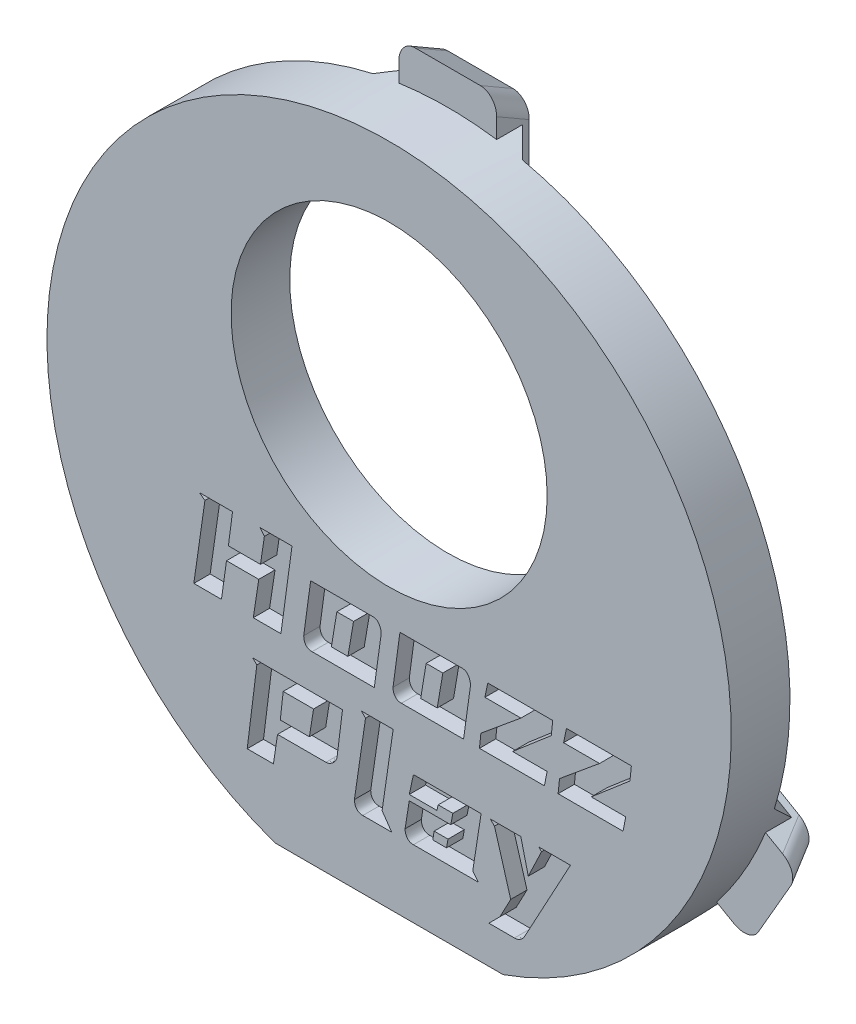
from build123d import *

# Parameters (mm, degrees)
SKETCH_1_R               = 10.5
EXTRUDE_1_DEPTH          = 1.8
CUT_EXTRUDE_4_DEPTH      = 2
CUT_EXTRUDE_4_DEPTH_BACK = 15.957941035
SKETCH_2_R               = 4.85
CUT_EXTRUDE_5_DEPTH      = 15.957941035
CUT_EXTRUDE_5_DEPTH_BACK = 15.957941035
SKETCH_3_W               = 7
SKETCH_3_H               = 1
SKETCH_4_W               = 3
SKETCH_4_H               = 3
EXTRUDE_2_DEPTH          = 1
PATTERN_CIRCULAR_1_COUNT = 3
CHAMFER_1_SIZE           = 1.732050808
CHAMFER_1_SIZE_2         = 1
FILLET_1_R               = 0.5
CHAMFER_2_SIZE           = 0.8
CUT_EXTRUDE_6_DEPTH      = 0.5


with BuildPart() as part:
    # 草图1 → 凸台-拉伸1 (new body)
    with BuildSketch(Plane.XY):
        Circle(SKETCH_1_R)
    extrude(amount=EXTRUDE_1_DEPTH)

    # 草图2 → 切除-拉伸4 (cut, two sides: drawn at the far end of the back side and taken through both)
    with BuildSketch(Plane.XY.offset(-CUT_EXTRUDE_4_DEPTH_BACK)):
        with Locations((0, 3.5)):
            Circle(SKETCH_2_R)
    extrude(amount=CUT_EXTRUDE_4_DEPTH + CUT_EXTRUDE_4_DEPTH_BACK, mode=Mode.SUBTRACT)

    # 草图3 → 切除-拉伸5 (cut, two sides: drawn at the far end of the back side and taken through both)
    with BuildSketch(Plane.XY.offset(-CUT_EXTRUDE_5_DEPTH_BACK)):
        with Locations((0, -10.4)):
            Rectangle(SKETCH_3_W, SKETCH_3_H)
    extrude(amount=CUT_EXTRUDE_5_DEPTH + CUT_EXTRUDE_5_DEPTH_BACK, mode=Mode.SUBTRACT)

    # 草图4 → 凸台-拉伸2 (add)
    with BuildSketch(Plane.XY):
        with Locations((0, 10.5)):
            Rectangle(SKETCH_4_W, SKETCH_4_H)
    extrude_2 = extrude(amount=-EXTRUDE_2_DEPTH)

    # 阵列(圆周)1: 凸台-拉伸2 ×3 about axis
    pattern_circular_1_axis = Axis((0, 0, 0), (0, 0, 1))
    for i in range(1, PATTERN_CIRCULAR_1_COUNT):
        add(extrude_2.rotate(pattern_circular_1_axis, i * 360 / PATTERN_CIRCULAR_1_COUNT))

    # 倒角1
    # the kernel refuses this chamfer: 1.732050808, 1 mm, written as the material it takes off along each edge
    with BuildSketch(Plane(origin=(-5.980963971, 12, -1), x_dir=(0, 0.01932676561270069, 0.9998132206222079), z_dir=(1, 0, 0)), Plane(origin=(-7.40182286, -11.179666738, -1), x_dir=(-0.016737469993586152, -0.009663382806350243, 0.9998132206222079), z_dir=(-0.49999999999999983, 0.8660254037844388, 0)), Plane(origin=(13.382786831, -0.820333262, -1), x_dir=(0.016737469993586093, -0.009663382806350228, 0.9998132206222079), z_dir=(-0.5000000000000004, -0.8660254037844384, 0))) as chamfer_1_piece_1:
        Polygon((CHAMFER_1_SIZE * 0.999813220373, CHAMFER_1_SIZE * 0.0193267656079), (-CHAMFER_1_SIZE_2 * 0.0193267656127, CHAMFER_1_SIZE_2 * 0.999813220622), (0, 0), align=None)
    extrude(amount=11.961927941, mode=Mode.SUBTRACT)

    # 圆角1
    fillet_1_edges = [part.edges().sort_by_distance(p)[0] for p in [
        (-9.026279442, -6.943375673, -0.5),
        (-10.526279442, -4.345299462, -0.5),
        (10.526279442, -4.345299462, -0.5),
        (9.026279442, -6.943375673, -0.5),
        (-1.5, 11.288675135, -0.5),
        (1.5, 11.288675135, -0.5),
    ]]
    fillet(fillet_1_edges, radius=FILLET_1_R)

    # 倒角2
    # the kernel refuses this chamfer: 0.8 mm, written as the material it adds along each edge
    with BuildSketch(Plane(origin=(-1.5, 9, 0), x_dir=(-0.9996219169112968, 0, 0.027495876610586386), z_dir=(0, 1, 0))) as chamfer_2_piece_1_section:
        Polygon((CHAMFER_2_SIZE * 0.999621916911, -CHAMFER_2_SIZE * 0.0274958766106), (-CHAMFER_2_SIZE * 0.0274958766106, -CHAMFER_2_SIZE * 0.999621916911), (0, 0), align=None)
    chamfer_2_piece_1 = extrude(amount=3.449651236, mode=Mode.PRIVATE)
    chamfer_2_piece_1 = chamfer_2_piece_1 & Plane(origin=(0, 0, -0.279589171), x_dir=(1, 0, 0), z_dir=(0, 0, -1)) * Cylinder(10.5, 11, mode=Mode.PRIVATE)
    chamfer_2_piece_1 = split(chamfer_2_piece_1, bisect_by=Plane(origin=(-1.748585836, 9.675774319, 0), z_dir=(0, 0, -1)), keep=Keep.TOP, mode=Mode.PRIVATE)
    add(chamfer_2_piece_1)
    with BuildSketch(Plane(origin=(1.5, 12.449651236, 0), x_dir=(0.9996219169112966, 0, 0.02749587661058636), z_dir=(0, -1, 0))) as chamfer_2_piece_2_section:
        Polygon((CHAMFER_2_SIZE * 0.999621916911, -CHAMFER_2_SIZE * 0.0274958766106), (-CHAMFER_2_SIZE * 0.0274958766106, -CHAMFER_2_SIZE * 0.999621916911), (0, 0), align=None)
    chamfer_2_piece_2 = extrude(amount=3.449651236, mode=Mode.PRIVATE)
    chamfer_2_piece_2 = chamfer_2_piece_2 & Plane(origin=(0, 0, -0.279589171), x_dir=(1, 0, 0), z_dir=(0, 0, -1)) * Cylinder(10.5, 11, mode=Mode.PRIVATE)
    chamfer_2_piece_2 = split(chamfer_2_piece_2, bisect_by=Plane(origin=(1.748585836, 9.675774319, 0), z_dir=(0, 0, -1)), keep=Keep.TOP, mode=Mode.PRIVATE)
    add(chamfer_2_piece_2)
    with BuildSketch(Plane(origin=(1.5, 9, 0), x_dir=(0, -0.9996219169112968, 0.027495876610586313), z_dir=(-1, 0, 0))) as chamfer_2_piece_3_section:
        Polygon((CHAMFER_2_SIZE * 0.999621916911, -CHAMFER_2_SIZE * 0.0274958766106), (-CHAMFER_2_SIZE * 0.0274958766106, -CHAMFER_2_SIZE * 0.999621916911), (0, 0), align=None)
    chamfer_2_piece_3 = extrude(amount=3, mode=Mode.PRIVATE)
    chamfer_2_piece_3 = chamfer_2_piece_3 - Plane(origin=(0, 3.5, -0.269439435), x_dir=(1, 0, 0), z_dir=(0, 0, -1)) * Cylinder(4.85, 10, mode=Mode.PRIVATE)
    add(chamfer_2_piece_3)
    with BuildSketch(Plane(origin=(-7.044228634, -5.799038106, 0), x_dir=(0.49981095845564827, -0.8656979742248805, 0.02749587661058638), z_dir=(-0.8660254037844387, -0.4999999999999999, 0))) as chamfer_2_piece_4_section:
        Polygon((CHAMFER_2_SIZE * 0.999621916911, -CHAMFER_2_SIZE * 0.0274958766106), (-CHAMFER_2_SIZE * 0.0274958766106, -CHAMFER_2_SIZE * 0.999621916911), (0, 0), align=None)
    chamfer_2_piece_4 = extrude(amount=3.449651236, mode=Mode.PRIVATE)
    chamfer_2_piece_4 = chamfer_2_piece_4 & Plane(origin=(0, 0, -0.279589171), x_dir=(1, 0, 0), z_dir=(0, 0, -1)) * Cylinder(10.5, 11, mode=Mode.PRIVATE)
    chamfer_2_piece_4 = split(chamfer_2_piece_4, bisect_by=Plane(origin=(-7.505173444, -6.352206914, 0), z_dir=(0, 0, -1)), keep=Keep.TOP, mode=Mode.PRIVATE)
    add(chamfer_2_piece_4)
    with BuildSketch(Plane(origin=(-11.531714238, -4.925787512, 0), x_dir=(-0.49981095845564827, 0.8656979742248805, 0.02749587661058638), z_dir=(0.8660254037844387, 0.4999999999999999, 0))) as chamfer_2_piece_5_section:
        Polygon((CHAMFER_2_SIZE * 0.999621916911, -CHAMFER_2_SIZE * 0.0274958766106), (-CHAMFER_2_SIZE * 0.0274958766106, -CHAMFER_2_SIZE * 0.999621916911), (0, 0), align=None)
    chamfer_2_piece_5 = extrude(amount=3.449651236, mode=Mode.PRIVATE)
    chamfer_2_piece_5 = chamfer_2_piece_5 & Plane(origin=(0, 0, -0.279589171), x_dir=(1, 0, 0), z_dir=(0, 0, -1)) * Cylinder(10.5, 11, mode=Mode.PRIVATE)
    chamfer_2_piece_5 = split(chamfer_2_piece_5, bisect_by=Plane(origin=(-9.25375928, -3.323567405, 0), z_dir=(0, 0, -1)), keep=Keep.TOP, mode=Mode.PRIVATE)
    add(chamfer_2_piece_5)
    with BuildSketch(Plane(origin=(-8.544228634, -3.200961894, 0), x_dir=(0.8656979742248805, 0.49981095845564827, 0.027495876610586396), z_dir=(0.49999999999999983, -0.8660254037844388, 0)), Plane(origin=(7.044228634, -5.799038106, 0), x_dir=(-0.86569797422488, 0.4998109584556489, 0.02749587661058638), z_dir=(0.5000000000000004, 0.8660254037844384, 0))) as chamfer_2_piece_6:
        Polygon((CHAMFER_2_SIZE * 0.999621916911, -CHAMFER_2_SIZE * 0.0274958766106), (-CHAMFER_2_SIZE * 0.0274958766106, -CHAMFER_2_SIZE * 0.999621916911), (0, 0), align=None)
    extrude(amount=3)
    with BuildSketch(Plane(origin=(8.544228634, -3.200961894, 0), x_dir=(-0.013747938305293389, -0.023812127644090495, -0.9996219169112968), z_dir=(0.8660254037844385, -0.5000000000000003, 0))) as chamfer_2_piece_7_section:
        Polygon((CHAMFER_2_SIZE * 0.999621916911, CHAMFER_2_SIZE * 0.0274958766106), (-CHAMFER_2_SIZE * 0.0274958766106, CHAMFER_2_SIZE * 0.999621916911), (0, 0), align=None)
    chamfer_2_piece_7 = extrude(amount=3.449651236, mode=Mode.PRIVATE)
    chamfer_2_piece_7 = split(chamfer_2_piece_7, bisect_by=Plane(origin=(9.25375928, -3.323567405, 0), z_dir=(0, 0, -1)), keep=Keep.TOP, mode=Mode.PRIVATE)
    chamfer_2_piece_7 = chamfer_2_piece_7 & Plane(origin=(0, 0, -0.279589171), x_dir=(1, 0, 0), z_dir=(0, 0, -1)) * Cylinder(10.5, 11, mode=Mode.PRIVATE)
    add(chamfer_2_piece_7)
    with BuildSketch(Plane(origin=(10.031714238, -7.523863724, 0), x_dir=(0.013747938305293155, 0.02381212764409009, -0.9996219169112968), z_dir=(-0.8660254037844385, 0.5000000000000003, 0))) as chamfer_2_piece_8_section:
        Polygon((CHAMFER_2_SIZE * 0.999621916911, CHAMFER_2_SIZE * 0.0274958766106), (-CHAMFER_2_SIZE * 0.0274958766106, CHAMFER_2_SIZE * 0.999621916911), (0, 0), align=None)
    chamfer_2_piece_8 = extrude(amount=3.449651236, mode=Mode.PRIVATE)
    chamfer_2_piece_8 = split(chamfer_2_piece_8, bisect_by=Plane(origin=(7.505173444, -6.352206914, 0), z_dir=(0, 0, -1)), keep=Keep.TOP, mode=Mode.PRIVATE)
    chamfer_2_piece_8 = chamfer_2_piece_8 & Plane(origin=(0, 0, -0.279589171), x_dir=(1, 0, 0), z_dir=(0, 0, -1)) * Cylinder(10.5, 11, mode=Mode.PRIVATE)
    add(chamfer_2_piece_8)
    with BuildSketch(Plane(origin=(-1.5, 6.94265361, 0), x_dir=(-0.9996219169112968, 0, 0.027495876610586376), z_dir=(0, 1, 0))) as chamfer_2_piece_9a_section:
        Polygon((CHAMFER_2_SIZE * 0.999621916911, -CHAMFER_2_SIZE * 0.0274958766106), (-CHAMFER_2_SIZE * 0.0274958766106, -CHAMFER_2_SIZE * 0.999621916911), (0, 0), align=None)
    chamfer_2_piece_9a = extrude(amount=5.506997626, mode=Mode.PRIVATE)
    chamfer_2_piece_9a = chamfer_2_piece_9a - Plane(origin=(0, 3.5, -0.268998588), x_dir=(1, 0, 0), z_dir=(0, 0, -1)) * Cylinder(4.85, 15, mode=Mode.PRIVATE)
    chamfer_2_piece_9a = split(chamfer_2_piece_9a, bisect_by=Plane(origin=(-1.768734313, 8.505474164, 0), z_dir=(0, 0, -1)), keep=Keep.TOP, mode=Mode.PRIVATE)
    chamfer_2_piece_9a = split(chamfer_2_piece_9a, bisect_by=Plane(origin=(-1.768734313, 9, -0.268998588), z_dir=(0, -1, 0)), keep=Keep.TOP, mode=Mode.PRIVATE)
    with BuildSketch(Plane(origin=(1.5, 9, 0), x_dir=(0, -0.9996219169112968, 0.027495876610586313), z_dir=(-1, 0, 0))) as chamfer_2_piece_9b_section:
        Polygon((CHAMFER_2_SIZE * 0.999621916911, -CHAMFER_2_SIZE * 0.0274958766106), (-CHAMFER_2_SIZE * 0.0274958766106, -CHAMFER_2_SIZE * 0.999621916911), (0, 0), align=None)
    chamfer_2_piece_9b = extrude(amount=5.05734639, mode=Mode.PRIVATE)
    chamfer_2_piece_9b = split(chamfer_2_piece_9b, bisect_by=Plane(origin=(-1.5, 8.736165099, -0.263834901), z_dir=(-1, 0, 0)), keep=Keep.TOP, mode=Mode.PRIVATE)
    chamfer_2_piece_9 = chamfer_2_piece_9a & chamfer_2_piece_9b
    add(chamfer_2_piece_9)
    with BuildSketch(Plane(origin=(3.55734639, 9, 0), x_dir=(0, -0.9996219169112968, 0.027495876610586313), z_dir=(-1, 0, 0))) as chamfer_2_piece_10a_section:
        Polygon((CHAMFER_2_SIZE * 0.999621916911, -CHAMFER_2_SIZE * 0.0274958766106), (-CHAMFER_2_SIZE * 0.0274958766106, -CHAMFER_2_SIZE * 0.999621916911), (0, 0), align=None)
    chamfer_2_piece_10a = extrude(amount=5.05734639, mode=Mode.PRIVATE)
    chamfer_2_piece_10a = split(chamfer_2_piece_10a, bisect_by=Plane(origin=(1.5, 8.736165099, -0.263834901), z_dir=(1, 0, 0)), keep=Keep.TOP, mode=Mode.PRIVATE)
    with BuildSketch(Plane(origin=(1.5, 12.449651236, 0), x_dir=(0.9996219169112966, 0, 0.02749587661058636), z_dir=(0, -1, 0))) as chamfer_2_piece_10b_section:
        Polygon((CHAMFER_2_SIZE * 0.999621916911, -CHAMFER_2_SIZE * 0.0274958766106), (-CHAMFER_2_SIZE * 0.0274958766106, -CHAMFER_2_SIZE * 0.999621916911), (0, 0), align=None)
    chamfer_2_piece_10b = extrude(amount=5.506997626, mode=Mode.PRIVATE)
    chamfer_2_piece_10b = chamfer_2_piece_10b - Plane(origin=(0, 3.5, -0.268998588), x_dir=(1, 0, 0), z_dir=(0, 0, -1)) * Cylinder(4.85, 15, mode=Mode.PRIVATE)
    chamfer_2_piece_10b = split(chamfer_2_piece_10b, bisect_by=Plane(origin=(1.768734313, 8.505474165, 0), z_dir=(0, 0, -1)), keep=Keep.TOP, mode=Mode.PRIVATE)
    chamfer_2_piece_10b = split(chamfer_2_piece_10b, bisect_by=Plane(origin=(1.768734313, 9, -0.268998588), z_dir=(0, -1, 0)), keep=Keep.TOP, mode=Mode.PRIVATE)
    chamfer_2_piece_10 = chamfer_2_piece_10a & chamfer_2_piece_10b
    add(chamfer_2_piece_10)
    with BuildSketch(Plane(origin=(-5.262514396, -4.77036491, 0), x_dir=(0.49981095845564827, -0.8656979742248805, 0.02749587661058638), z_dir=(-0.8660254037844387, -0.4999999999999999, 0))) as chamfer_2_piece_11a_section:
        Polygon((CHAMFER_2_SIZE * 0.999621916911, -CHAMFER_2_SIZE * 0.0274958766106), (-CHAMFER_2_SIZE * 0.0274958766106, -CHAMFER_2_SIZE * 0.999621916911), (0, 0), align=None)
    chamfer_2_piece_11a = extrude(amount=5.506997626, mode=Mode.PRIVATE)
    chamfer_2_piece_11a = split(chamfer_2_piece_11a, bisect_by=Plane(origin=(-6.026659592, -5.504172996, 0), z_dir=(0, 0, -1)), keep=Keep.TOP, mode=Mode.PRIVATE)
    chamfer_2_piece_11a = split(chamfer_2_piece_11a, bisect_by=Plane(origin=(-6.917516711, -6.018509594, -0.277045355), z_dir=(0.8660254037844388, 0.49999999999999983, 0)), keep=Keep.TOP, mode=Mode.PRIVATE)
    with BuildSketch(Plane(origin=(-8.544228634, -3.200961894, 0), x_dir=(0.8656979742248805, 0.49981095845564827, 0.027495876610586396), z_dir=(0.49999999999999983, -0.8660254037844388, 0))) as chamfer_2_piece_11b_section:
        Polygon((CHAMFER_2_SIZE * 0.999621916911, -CHAMFER_2_SIZE * 0.0274958766106), (-CHAMFER_2_SIZE * 0.0274958766106, -CHAMFER_2_SIZE * 0.999621916911), (0, 0), align=None)
    chamfer_2_piece_11b = extrude(amount=5.05734639, mode=Mode.PRIVATE)
    chamfer_2_piece_11b = split(chamfer_2_piece_11b, bisect_by=Plane(origin=(-6.815740907, -5.667120655, -0.263834901), z_dir=(0.4999999999999999, -0.8660254037844387, 0)), keep=Keep.TOP, mode=Mode.PRIVATE)
    chamfer_2_piece_11 = chamfer_2_piece_11a & chamfer_2_piece_11b
    add(chamfer_2_piece_11)
    with BuildSketch(Plane(origin=(-9.572901829, -1.419247656, 0), x_dir=(0.8656979742248805, 0.49981095845564827, 0.0274958766105864), z_dir=(0.49999999999999983, -0.8660254037844388, 0))) as chamfer_2_piece_12a_section:
        Polygon((CHAMFER_2_SIZE * 0.999621916911, -CHAMFER_2_SIZE * 0.0274958766106), (-CHAMFER_2_SIZE * 0.0274958766106, -CHAMFER_2_SIZE * 0.999621916911), (0, 0), align=None)
    chamfer_2_piece_12a = extrude(amount=5.05734639, mode=Mode.PRIVATE)
    chamfer_2_piece_12a = split(chamfer_2_piece_12a, bisect_by=Plane(origin=(-8.315740907, -3.069044444, -0.263834901), z_dir=(-0.4999999999999999, 0.8660254037844387, 0)), keep=Keep.TOP, mode=Mode.PRIVATE)
    with BuildSketch(Plane(origin=(-11.531714238, -4.925787512, 0), x_dir=(-0.49981095845564827, 0.8656979742248805, 0.02749587661058638), z_dir=(0.8660254037844387, 0.4999999999999999, 0))) as chamfer_2_piece_12b_section:
        Polygon((CHAMFER_2_SIZE * 0.999621916911, -CHAMFER_2_SIZE * 0.0274958766106), (-CHAMFER_2_SIZE * 0.0274958766106, -CHAMFER_2_SIZE * 0.999621916911), (0, 0), align=None)
    chamfer_2_piece_12b = extrude(amount=5.506997626, mode=Mode.PRIVATE)
    chamfer_2_piece_12b = split(chamfer_2_piece_12b, bisect_by=Plane(origin=(-7.780083438, -2.467153808, 0), z_dir=(0, 0, -1)), keep=Keep.TOP, mode=Mode.PRIVATE)
    chamfer_2_piece_12b = split(chamfer_2_piece_12b, bisect_by=Plane(origin=(-8.670940557, -2.981490406, -0.277045355), z_dir=(0.8660254037844388, 0.49999999999999983, 0)), keep=Keep.TOP, mode=Mode.PRIVATE)
    chamfer_2_piece_12 = chamfer_2_piece_12a & chamfer_2_piece_12b
    add(chamfer_2_piece_12)
    with BuildSketch(Plane(origin=(6.762514396, -2.172288699, 0), x_dir=(-0.013747938305293656, -0.02381212764409096, -0.9996219169112966), z_dir=(0.8660254037844385, -0.5000000000000003, 0))) as chamfer_2_piece_13a_section:
        Polygon((CHAMFER_2_SIZE * 0.999621916911, CHAMFER_2_SIZE * 0.0274958766106), (-CHAMFER_2_SIZE * 0.0274958766106, CHAMFER_2_SIZE * 0.999621916911), (0, 0), align=None)
    chamfer_2_piece_13a = extrude(amount=5.506997626, mode=Mode.PRIVATE)
    chamfer_2_piece_13a = split(chamfer_2_piece_13a, bisect_by=Plane(origin=(7.780083438, -2.467153808, 0), z_dir=(0, 0, -1)), keep=Keep.TOP, mode=Mode.PRIVATE)
    chamfer_2_piece_13a = split(chamfer_2_piece_13a, bisect_by=Plane(origin=(8.670940557, -2.981490406, -0.277045355), z_dir=(-0.8660254037844384, 0.5000000000000004, 0)), keep=Keep.TOP, mode=Mode.PRIVATE)
    with BuildSketch(Plane(origin=(7.044228634, -5.799038106, 0), x_dir=(-0.86569797422488, 0.4998109584556489, 0.02749587661058638), z_dir=(0.5000000000000004, 0.8660254037844384, 0))) as chamfer_2_piece_13b_section:
        Polygon((CHAMFER_2_SIZE * 0.999621916911, -CHAMFER_2_SIZE * 0.0274958766106), (-CHAMFER_2_SIZE * 0.0274958766106, -CHAMFER_2_SIZE * 0.999621916911), (0, 0), align=None)
    chamfer_2_piece_13b = extrude(amount=5.05734639, mode=Mode.PRIVATE)
    chamfer_2_piece_13b = split(chamfer_2_piece_13b, bisect_by=Plane(origin=(8.315740907, -3.069044444, -0.263834901), z_dir=(0.5000000000000003, 0.8660254037844385, 0)), keep=Keep.TOP, mode=Mode.PRIVATE)
    chamfer_2_piece_13 = chamfer_2_piece_13a & chamfer_2_piece_13b
    add(chamfer_2_piece_13)
    with BuildSketch(Plane(origin=(10.031714238, -7.523863724, 0), x_dir=(0.013747938305293155, 0.02381212764409009, -0.9996219169112968), z_dir=(-0.8660254037844385, 0.5000000000000003, 0))) as chamfer_2_piece_14a_section:
        Polygon((CHAMFER_2_SIZE * 0.999621916911, CHAMFER_2_SIZE * 0.0274958766106), (-CHAMFER_2_SIZE * 0.0274958766106, CHAMFER_2_SIZE * 0.999621916911), (0, 0), align=None)
    chamfer_2_piece_14a = extrude(amount=5.506997626, mode=Mode.PRIVATE)
    chamfer_2_piece_14a = split(chamfer_2_piece_14a, bisect_by=Plane(origin=(6.026659592, -5.504172996, 0), z_dir=(0, 0, -1)), keep=Keep.TOP, mode=Mode.PRIVATE)
    chamfer_2_piece_14a = split(chamfer_2_piece_14a, bisect_by=Plane(origin=(6.917516711, -6.018509594, -0.277045355), z_dir=(-0.8660254037844384, 0.5000000000000004, 0)), keep=Keep.TOP, mode=Mode.PRIVATE)
    with BuildSketch(Plane(origin=(6.015555439, -7.580752344, 0), x_dir=(-0.86569797422488, 0.4998109584556489, 0.02749587661058636), z_dir=(0.5000000000000004, 0.8660254037844384, 0))) as chamfer_2_piece_14b_section:
        Polygon((CHAMFER_2_SIZE * 0.999621916911, -CHAMFER_2_SIZE * 0.0274958766106), (-CHAMFER_2_SIZE * 0.0274958766106, -CHAMFER_2_SIZE * 0.999621916911), (0, 0), align=None)
    chamfer_2_piece_14b = extrude(amount=5.05734639, mode=Mode.PRIVATE)
    chamfer_2_piece_14b = split(chamfer_2_piece_14b, bisect_by=Plane(origin=(6.815740907, -5.667120655, -0.263834901), z_dir=(-0.5000000000000003, -0.8660254037844385, 0)), keep=Keep.TOP, mode=Mode.PRIVATE)
    chamfer_2_piece_14 = chamfer_2_piece_14a & chamfer_2_piece_14b
    add(chamfer_2_piece_14)

    # 草图5 → 切除-拉伸6 (cut)
    # profile 1 of 9: a face of its own
    with BuildSketch(Plane.XY.offset(1.8)):
        Polygon((-4.804741168, -1.748766745), (-4.932553028, -2.720775947), (-3.94776264, -2.720775947), (-3.82825855, -1.916839342), (-3.95670947, -1.748766745), (-2.980226853, -1.748766745), (-3.320206403, -4.248766745), (-4.1682381, -4.248766745), (-4.000804562, -3.144472266), (-4.990068366, -3.144472266), (-5.144720718, -4.248766745), (-5.992752415, -4.248766745), (-5.652772865, -1.87274425), (-5.824679818, -1.748766745), align=None)
    # profile 2 of 9: a face of its own
    with BuildSketch(Plane.XY.offset(1.8)):
        with BuildLine():
            add(Edge.make_bspline(
                [(-0.500037691, -2.384630753), (-0.47982185, -2.385673226), (-0.440858561, -2.387682452), (-0.386693087, -2.408468319), (-0.340781962, -2.442156269), (-0.305947594, -2.488663729), (-0.278066084, -2.541265014), (-0.258584101, -2.598527258), (-0.24566888, -2.658637837), (-0.244413304, -2.699831258), (-0.24377491, -2.720775947)],
                knots=[0, 0, 0, 0, 1.02234591, 1.970432971, 2.898382147, 3.87634708, 4.892323529, 5.911575754, 6.938146016, 8, 8, 8, 8], degree=3))
            Line((-0.24377491, -2.720775947), (-0.455942599, -4.248766745))
            Line((-0.455942599, -4.248766745), (-2.364173683, -4.248766745))
            add(Edge.make_bspline(
                [(-2.364173683, -4.248766745), (-2.384328025, -4.247984566), (-2.422592318, -4.246499551), (-2.475960141, -4.229911445), (-2.521546028, -4.203227038), (-2.55836732, -4.165891895), (-2.586381802, -4.12062231), (-2.606003456, -4.069379347), (-2.618678536, -4.012926772), (-2.619835628, -3.973404679), (-2.620436464, -3.952882287)],
                knots=[0, 0, 0, 0, 1.089429456, 2.068350618, 2.995211323, 3.926091889, 4.8808759, 5.860886264, 6.889235676, 8, 8, 8, 8], degree=3))
            Line((-2.620436464, -3.952882287), (-2.408268775, -2.384630753))
            Line((-2.408268775, -2.384630753), (-0.500037691, -2.384630753))
        make_face()
        Polygon((-1.60433217, -2.808966131), (-1.771765707, -3.825070426), (-1.264352619, -3.825070426), (-1.091806607, -2.808966131), align=None, mode=Mode.SUBTRACT)
    # profile 3 of 9: a face of its own
    with BuildSketch(Plane.XY.offset(1.8)):
        with BuildLine():
            add(Edge.make_bspline(
                [(2.240248608, -2.384630753), (2.260464448, -2.385673226), (2.299427737, -2.387682452), (2.353593211, -2.408468319), (2.399504337, -2.442156269), (2.434338705, -2.488663729), (2.462220214, -2.541265014), (2.481702197, -2.598527258), (2.494617418, -2.658637837), (2.495872994, -2.699831258), (2.496511389, -2.720775947)],
                knots=[0, 0, 0, 0, 1.02234591, 1.970432971, 2.898382147, 3.87634708, 4.892323529, 5.911575754, 6.938146016, 8, 8, 8, 8], degree=3))
            Line((2.496511389, -2.720775947), (2.2843437, -4.248766745))
            Line((2.2843437, -4.248766745), (0.376112616, -4.248766745))
            add(Edge.make_bspline(
                [(0.376112616, -4.248766745), (0.355958273, -4.247984566), (0.317693981, -4.246499551), (0.264326158, -4.229911445), (0.218740271, -4.203227038), (0.181918978, -4.165891895), (0.153904497, -4.12062231), (0.134282842, -4.069379347), (0.121607762, -4.012926772), (0.12045067, -3.973404679), (0.119849835, -3.952882287)],
                knots=[0, 0, 0, 0, 1.089429456, 2.068350618, 2.995211323, 3.926091889, 4.8808759, 5.860886264, 6.889235676, 8, 8, 8, 8], degree=3))
            Line((0.119849835, -3.952882287), (0.332017524, -2.384630753))
            Line((0.332017524, -2.384630753), (2.240248608, -2.384630753))
        make_face()
        Polygon((1.135954129, -2.808966131), (0.968520591, -3.825070426), (1.475933679, -3.825070426), (1.648479691, -2.808966131), align=None, mode=Mode.SUBTRACT)
    # profile 4 of 9: a face of its own
    with BuildSketch(Plane.XY.offset(1.8)):
        Polygon((2.940018546, -2.808966131), (3.02820873, -2.384630753), (5.020156583, -2.384630753), (4.976061491, -2.808966131), (3.788050244, -3.825070426), (4.84824963, -3.825070426), (4.764532861, -4.248766745), (2.771945949, -4.248766745), (2.816041041, -3.825070426), (4.044313025, -2.808966131), align=None)
    # profile 5 of 9: a face of its own
    with BuildSketch(Plane.XY.offset(1.8)):
        Polygon((5.353106481, -2.808966131), (5.441296665, -2.384630753), (7.433244518, -2.384630753), (7.389149426, -2.808966131), (6.201138178, -3.825070426), (7.261337565, -3.825070426), (7.177620796, -4.248766745), (5.185033884, -4.248766745), (5.229128976, -3.825070426), (6.457400959, -2.808966131), align=None)
    # profile 6 of 9: a face of its own
    with BuildSketch(Plane.XY.offset(1.8)):
        with BuildLine():
            Line((-1.430665461, -5.323858599), (-1.598738058, -6.679942443))
            add(Edge.make_bspline(
                [(-1.598738058, -6.679942443), (-1.605262429, -6.700691145), (-1.61815229, -6.741683282), (-1.650019608, -6.797775399), (-1.689080283, -6.849125692), (-1.736565647, -6.89248697), (-1.786759246, -6.928726725), (-1.837659041, -6.955363497), (-1.888170079, -6.972825652), (-1.922188282, -6.974845476), (-1.938717608, -6.975826901)],
                knots=[0, 0, 0, 0, 1.086086389, 2.145724782, 3.210128507, 4.304196138, 5.351744953, 6.300929231, 7.174427428, 8, 8, 8, 8], degree=3))
            Line((-1.938717608, -6.975826901), (-3.423252373, -6.975826901))
            Line((-3.423252373, -6.975826901), (-3.551064234, -7.823858599))
            Line((-3.551064234, -7.823858599), (-4.355000839, -7.823858599))
            Line((-4.355000839, -7.823858599), (-4.059116381, -5.447836104))
            Line((-4.059116381, -5.447836104), (-4.186928242, -5.323858599))
            Line((-4.186928242, -5.323858599), (-1.430665461, -5.323858599))
        make_face()
        Polygon((-3.250706361, -5.748193977), (-3.338896545, -6.552130582), (-2.446769756, -6.552130582), (-2.318957895, -5.748193977), align=None, mode=Mode.SUBTRACT)
    # profile 7 of 9: a face of its own
    with BuildSketch(Plane.XY.offset(1.8)):
        with BuildLine():
            Line((0.124165827, -5.067595817), (-0.215813723, -7.40016228))
            Line((-0.215813723, -7.40016228), (0.080070735, -7.823858599))
            Line((0.080070735, -7.823858599), (-0.808221698, -7.823858599))
            add(Edge.make_bspline(
                [(-0.808221698, -7.823858599), (-0.828376041, -7.82307642), (-0.866640333, -7.821591405), (-0.920008156, -7.805003299), (-0.965594043, -7.778318892), (-1.002415336, -7.740983749), (-1.030429817, -7.695714164), (-1.050051472, -7.644471201), (-1.062726552, -7.588018625), (-1.063883644, -7.548496533), (-1.06448448, -7.527974141)],
                knots=[0, 0, 0, 0, 1.089429456, 2.068350618, 2.995211323, 3.926091889, 4.8808759, 5.860886264, 6.889235676, 8, 8, 8, 8], degree=3))
            Line((-1.06448448, -7.527974141), (-0.72386587, -5.196046738))
            Line((-0.72386587, -5.196046738), (-0.85231679, -5.067595817))
            Line((-0.85231679, -5.067595817), (0.124165827, -5.067595817))
        make_face()
    # profile 8 of 9: a face of its own
    with BuildSketch(Plane.XY.offset(1.8)):
        with BuildLine():
            Line((1.956348854, -6.384057985), (1.505812044, -6.384057985))
            Line((1.505812044, -6.384057985), (1.466190367, -6.552130582))
            Line((1.466190367, -6.552130582), (0.61815867, -6.552130582))
            Line((0.61815867, -6.552130582), (0.745970531, -5.959722607))
            Line((0.745970531, -5.959722607), (2.822274212, -5.959722607))
            Line((2.822274212, -5.959722607), (2.56601143, -7.612329969))
            Line((2.56601143, -7.612329969), (2.738557443, -7.823858599))
            Line((2.738557443, -7.823858599), (0.745970531, -7.823858599))
            add(Edge.make_bspline(
                [(0.745970531, -7.823858599), (0.725816188, -7.82307642), (0.687551896, -7.821591405), (0.634184073, -7.805003299), (0.588598186, -7.778318892), (0.551776893, -7.740983749), (0.523762412, -7.695714164), (0.504140757, -7.644471201), (0.491465677, -7.588018625), (0.490308585, -7.548496533), (0.48970775, -7.527974141)],
                knots=[0, 0, 0, 0, 1.089429456, 2.068350618, 2.995211323, 3.926091889, 4.8808759, 5.860886264, 6.889235676, 8, 8, 8, 8], degree=3))
            Line((0.48970775, -7.527974141), (0.61815867, -6.71956412))
            Line((0.61815867, -6.71956412), (1.890525745, -6.71956412))
            Line((1.890525745, -6.71956412), (1.956348854, -6.384057985))
        make_face()
        Polygon((1.382473598, -7.143899498), (1.338378506, -7.40016228), (1.762074825, -7.40016228), (1.806169917, -7.143899498), align=None, mode=Mode.SUBTRACT)
    # profile 9 of 9: a face of its own
    with BuildSketch(Plane.XY.offset(1.8)):
        with BuildLine():
            Line((3.232550285, -6.088173527), (3.10857278, -5.959722607))
            Line((3.10857278, -5.959722607), (4.040960306, -5.959722607))
            Line((4.040960306, -5.959722607), (4.270382596, -6.896583548))
            Line((4.270382596, -6.896583548), (4.676824314, -6.044078435))
            Line((4.676824314, -6.044078435), (4.593107545, -5.959722607))
            Line((4.593107545, -5.959722607), (5.564477688, -5.959722607))
            Line((5.564477688, -5.959722607), (4.142570735, -8.583700112))
            add(Edge.make_bspline(
                [(4.142570735, -8.583700112), (4.136124174, -8.594212482), (4.122799032, -8.615941712), (4.09453754, -8.64416657), (4.063075381, -8.673581242), (4.025107501, -8.699370856), (3.984272166, -8.722719695), (3.940111604, -8.739403133), (3.894063462, -8.750103958), (3.862507994, -8.751215426), (3.846686277, -8.751772709)],
                knots=[0, 0, 0, 0, 0.831879208, 1.719507044, 2.689520821, 3.74564016, 4.817103914, 5.866903859, 6.930478712, 8, 8, 8, 8], degree=3))
            Line((3.846686277, -8.751772709), (3.060004273, -8.751772709))
            Line((3.060004273, -8.751772709), (3.399983823, -8.411793159))
            Line((3.399983823, -8.411793159), (3.731655602, -7.784236922))
            Line((3.731655602, -7.784236922), (3.232550285, -6.088173527))
        make_face()
    extrude(amount=-CUT_EXTRUDE_6_DEPTH, mode=Mode.SUBTRACT)


solid = part.part
